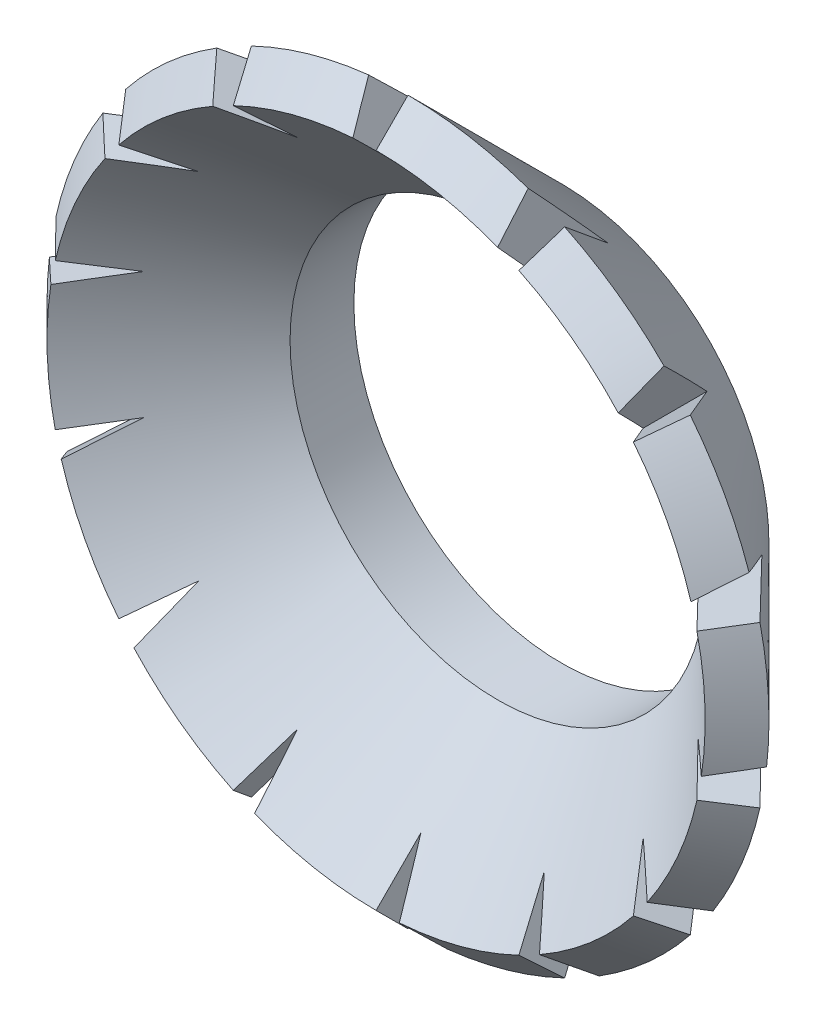
from build123d import *

# Parameters (mm, degrees)
CUT_EXTRUDE1_DEPTH = 7.018062938
TYPEAPATTEN_COUNT  = 14


with BuildPart() as part:
    # Sketch1 → Revolve1 (revolve)
    with BuildSketch(Plane(origin=(0, 0, 0), x_dir=(1, 0, 0), z_dir=(0, 1, 0))):
        Polygon((2.3, 0), (4, -1.7), (3.646446609, -2.053553391), (2.3, -0.707106781), align=None)
    revolve(axis=Axis((0, 0, -3.757972585), (0, 0, 1)))

    # Sketch2 → Cut-Extrude1 (cut, through all)
    with BuildSketch(Plane.XY):
        Polygon((0, 4), (-0.448798951, 4), (0, 3.15), align=None)
    cut_extrude1 = extrude(amount=CUT_EXTRUDE1_DEPTH, mode=Mode.SUBTRACT)

    # TypeApatten: Cut-Extrude1 ×14 about axis
    typeapatten_axis = Axis((0, 0, -9.015419969), (0, 0, 1))
    for i in range(1, TYPEAPATTEN_COUNT):
        add(cut_extrude1.rotate(typeapatten_axis, i * 360 / TYPEAPATTEN_COUNT), mode=Mode.SUBTRACT)


solid = part.part
